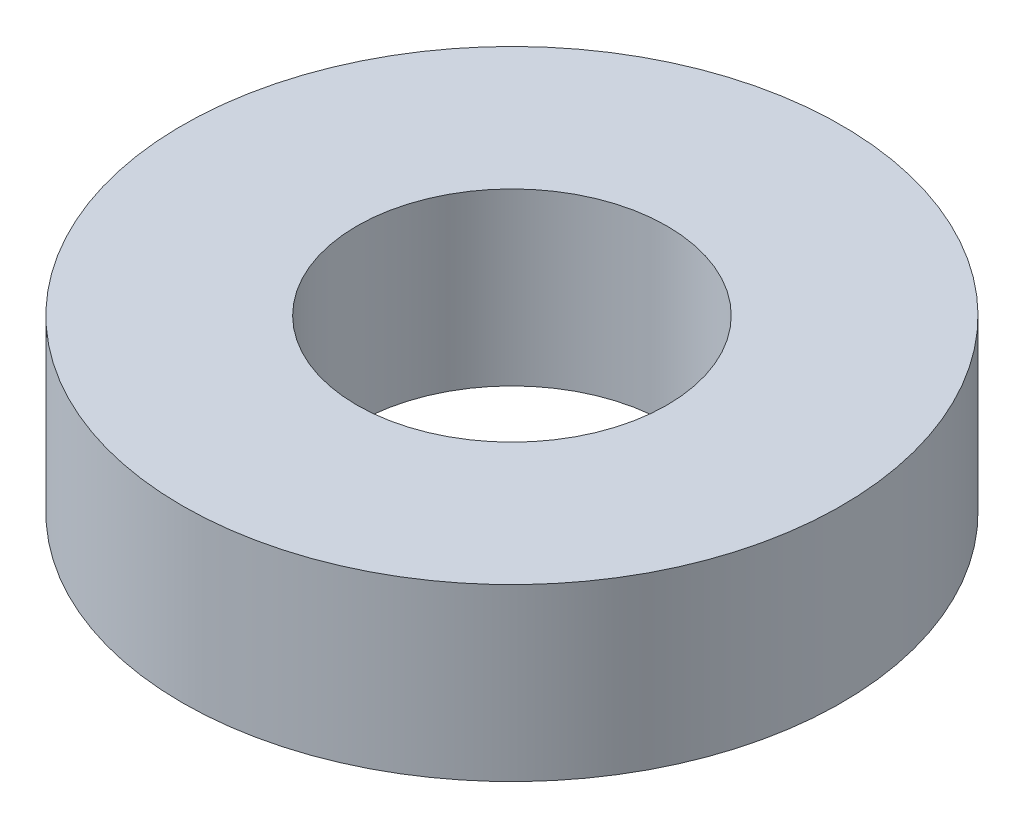
from build123d import *

# Parameters (mm, degrees)
SKETCH1_R           = 42.5
BOSS_EXTRUDE1_DEPTH = 22
SKETCH2_R           = 20
CUT_EXTRUDE1_DEPTH  = 65.003906131


with BuildPart() as part:
    # Sketch1 → Boss-Extrude1 (new body)
    with BuildSketch(Plane(origin=(0, 0, 0), x_dir=(1, 0, 0), z_dir=(0, 1, 0))):
        Circle(SKETCH1_R)
    extrude(amount=BOSS_EXTRUDE1_DEPTH)

    # Sketch2 → Cut-Extrude1 (cut, through all)
    with BuildSketch(Plane(origin=(0, 0, 0), x_dir=(1, 0, 0), z_dir=(0, 1, 0))):
        Circle(SKETCH2_R)
    extrude(amount=CUT_EXTRUDE1_DEPTH, mode=Mode.SUBTRACT)


solid = part.part
